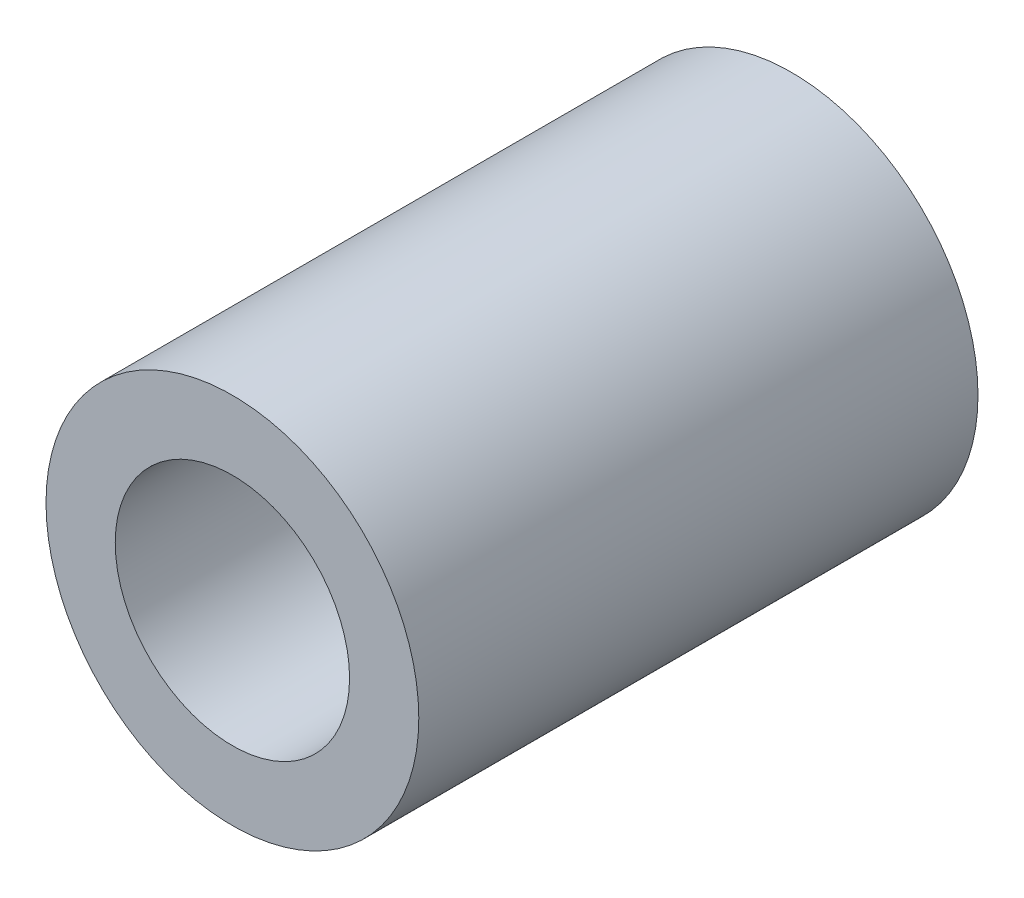
from build123d import *

# Parameters (mm, degrees)
SKETCH1_R           = 7
SKETCH1_R_2         = 4.4
BOSS_EXTRUDE1_DEPTH = 21


with BuildPart() as part:
    # Sketch1 → Boss-Extrude1 (new body)
    with BuildSketch(Plane.XY):
        Circle(SKETCH1_R)
        Circle(SKETCH1_R_2, mode=Mode.SUBTRACT)
    extrude(amount=BOSS_EXTRUDE1_DEPTH)


solid = part.part
